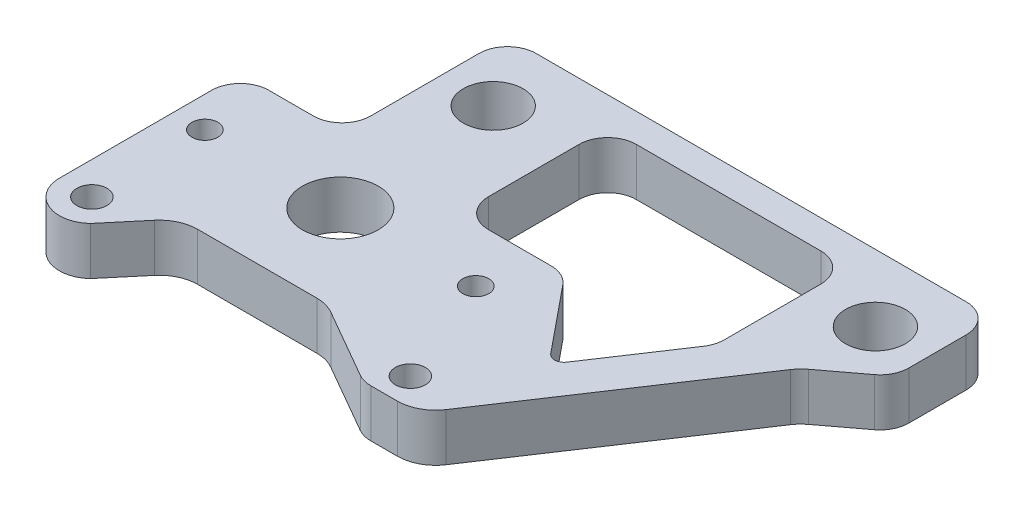
from build123d import *

# Parameters (mm, degrees)
SKETCH4_R           = 2
SKETCH4_R_2         = 1.7272
SKETCH4_R_3         = 5.04
SKETCH4_R_4         = 3.96875
BOSS_EXTRUDE2_DEPTH = 6.35
FILLET1_R           = 5.08
FILLET7_R           = 3.81
FILLET8_R           = 1.27
FILLET9_R           = 5.08


with BuildPart() as part:
    # Sketch4 → Boss-Extrude2 (new body)
    with BuildSketch(Plane(origin=(0, 0, 0), x_dir=(1, 0, 0), z_dir=(0, 1, 0))):
        with BuildLine():
            Line((22.483900583, -18.4375), (28.735494078, -18.4375))
            Line((28.735494078, -18.4375), (48.985566477, 12.027918285))
            Line((48.985566477, 12.027918285), (54.680415238, 16.319294633))
            ThreePointArc((54.680415238, 16.319294633), (55.797199918, 17.662082259), (56.1975, 19.362095927))
            Line((56.1975, 19.362095927), (56.1975, 26.9875))
            ThreePointArc((56.1975, 26.9875), (55.081576836, 29.681576836), (52.3875, 30.7975))
            Line((52.3875, 30.7975), (-4.7625, 30.7975))
            ThreePointArc((-4.7625, 30.7975), (-7.456576836, 29.681576836), (-8.5725, 26.9875))
            Line((-8.5725, 26.9875), (-8.5725, 12.607500122))
            ThreePointArc((-8.5725, 12.607500122), (-9.688423164, 9.913423286), (-12.3825, 8.797500122))
            Line((-12.3825, 8.797500122), (-18.288, 8.797500122))
            ThreePointArc((-18.288, 8.797500122), (-20.982076836, 7.681576958), (-22.098, 4.987500122))
            Line((-22.098, 4.987500122), (-22.098, -15.24))
            ThreePointArc((-22.098, -15.24), (-19.494143335, -19.203185162), (-14.822948297, -18.386580561))
            Line((-14.822948297, -18.386580561), (-9.399713355, -11.933490986))
            Line((-9.399713355, -11.933490986), (10.16293305, -11.933490986))
            Line((10.16293305, -11.933490986), (20.583679925, -17.929811531))
            ThreePointArc((20.583679925, -17.929811531), (21.500464498, -18.308390309), (22.483900583, -18.4375))
        make_face()
        with Locations((-17.78, -15.24)):
            Circle(SKETCH4_R, mode=Mode.SUBTRACT)
        with Locations((-18.000000004, 0)):
            Circle(SKETCH4_R_2, mode=Mode.SUBTRACT)
        Circle(SKETCH4_R_3, mode=Mode.SUBTRACT)
        with Locations((24.012521227, -14.703599027)):
            Circle(SKETCH4_R, mode=Mode.SUBTRACT)
        with Locations((18.000000004, 0)):
            Circle(SKETCH4_R_2, mode=Mode.SUBTRACT)
        with Locations((-1.5875, 21.9075)):
            Circle(SKETCH4_R_4, mode=Mode.SUBTRACT)
        with BuildLine():
            ThreePointArc((8.544719667, 23.1775), (9.660642831, 25.871576836), (12.354719667, 26.9875))
            Line((12.354719667, 26.9875), (40.692955064, 26.9875))
            Line((40.692955064, 26.9875), (40.692955064, 9.18064836))
            Line((40.692955064, 9.18064836), (31.847156025, -4.1275))
            Line((31.847156025, -4.1275), (22.483900583, 7.345648238))
            Line((22.483900583, 7.345648238), (8.544719667, 7.345648238))
            Line((8.544719667, 7.345648238), (8.544719667, 23.1775))
        make_face(mode=Mode.SUBTRACT)
        with Locations((49.2125, 21.9075)):
            Circle(SKETCH4_R_4, mode=Mode.SUBTRACT)
    extrude(amount=-BOSS_EXTRUDE2_DEPTH)

    # Fillet1
    fillet1_edges = [part.edges().sort_by_distance(p)[0] for p in [
        (48.985566477, -3.175, -12.027918285),
        (28.735494078, -3.175, 18.4375),
    ]]
    fillet(fillet1_edges, radius=FILLET1_R)

    # Fillet7
    fillet7_edges = [part.edges().sort_by_distance(p)[0] for p in [
        (8.544719667, -3.175, -7.345648238),
        (22.483900583, -3.175, -7.345648238),
        (40.692955064, -3.175, -9.18064836),
        (40.692955064, -3.175, -26.9875),
    ]]
    fillet(fillet7_edges, radius=FILLET7_R)

    # Fillet8
    fillet8_edges = [part.edges().sort_by_distance(p)[0] for p in [
        (31.847156025, -3.175, 4.1275),
    ]]
    fillet(fillet8_edges, radius=FILLET8_R)

    # Fillet9
    fillet9_edges = [part.edges().sort_by_distance(p)[0] for p in [
        (10.16293305, -3.175, 11.933490986),
        (-9.399713355, -3.175, 11.933490986),
    ]]
    fillet(fillet9_edges, radius=FILLET9_R)


solid = part.part
